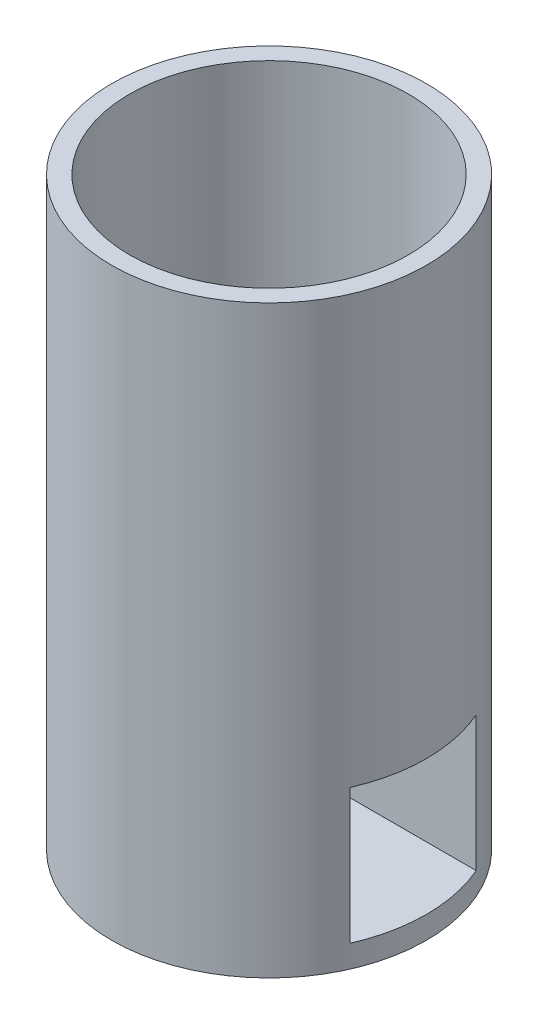
from build123d import *

# Parameters (mm, degrees)
SKETCH1_W               = 25
SKETCH1_H               = 16
BOSS_EXTRUDE1_DEPTH     = 20
SKETCH6_R               = 17.5
BOSS_EXTRUDE4_DEPTH     = 65
CUT_EXTRUDE1_DEPTH      = 65
CUT_EXTRUDE1_DEPTH_BACK = 40
SKETCH2_W               = 14
SKETCH2_H               = 15
SKETCH3_R               = 1.05
CUT_EXTRUDE2_DEPTH      = 10
SKETCH7_R               = 15.5
CUT_EXTRUDE3_DEPTH      = 30


with BuildPart() as part:
    # Sketch1 → Boss-Extrude1 (new body)
    with BuildSketch(Plane(origin=(0, 0, 0), x_dir=(1, 0, 0), z_dir=(0, 1, 0))):
        with Locations((3.281818182, -1.972727273)):
            Rectangle(SKETCH1_W, SKETCH1_H)
    extrude(amount=BOSS_EXTRUDE1_DEPTH)

    # Sketch6 → Boss-Extrude4 (add)
    with BuildSketch(Plane(origin=(0, 0, 0), x_dir=(1, 0, 0), z_dir=(0, 1, 0))):
        with Locations((3.872523773, -1.953116283)):
            Circle(SKETCH6_R)
    extrude(amount=BOSS_EXTRUDE4_DEPTH)

    # Sketch2 → Cut-Extrude1 (cut, two sides: drawn at the far end of the back side and taken through both)
    with BuildSketch(Plane.ZY.offset(9.218181818).offset(-CUT_EXTRUDE1_DEPTH_BACK)):
        with Locations((1.972727273, 10)):
            Rectangle(SKETCH2_W, SKETCH2_H)
    extrude(amount=CUT_EXTRUDE1_DEPTH + CUT_EXTRUDE1_DEPTH_BACK, mode=Mode.SUBTRACT)

    # Sketch3 → Cut-Extrude2 (cut)
    with BuildSketch(Plane(origin=(0, 0, 0), x_dir=(-1, 0, 0), z_dir=(0, -1, 0))):
        with Locations((-9.781818182, -1.972727273)):
            Circle(SKETCH3_R)
        with Locations((0.218181818, -1.972727273)):
            Circle(SKETCH3_R)
    extrude(amount=-CUT_EXTRUDE2_DEPTH, mode=Mode.SUBTRACT)

    # Sketch7 → Cut-Extrude3 (cut)
    with BuildSketch(Plane(origin=(0, 65, 0), x_dir=(1, 0, 0), z_dir=(0, 1, 0))):
        with Locations((3.872523773, -1.953116283)):
            Circle(SKETCH7_R)
    extrude(amount=-CUT_EXTRUDE3_DEPTH, mode=Mode.SUBTRACT)


solid = part.part
